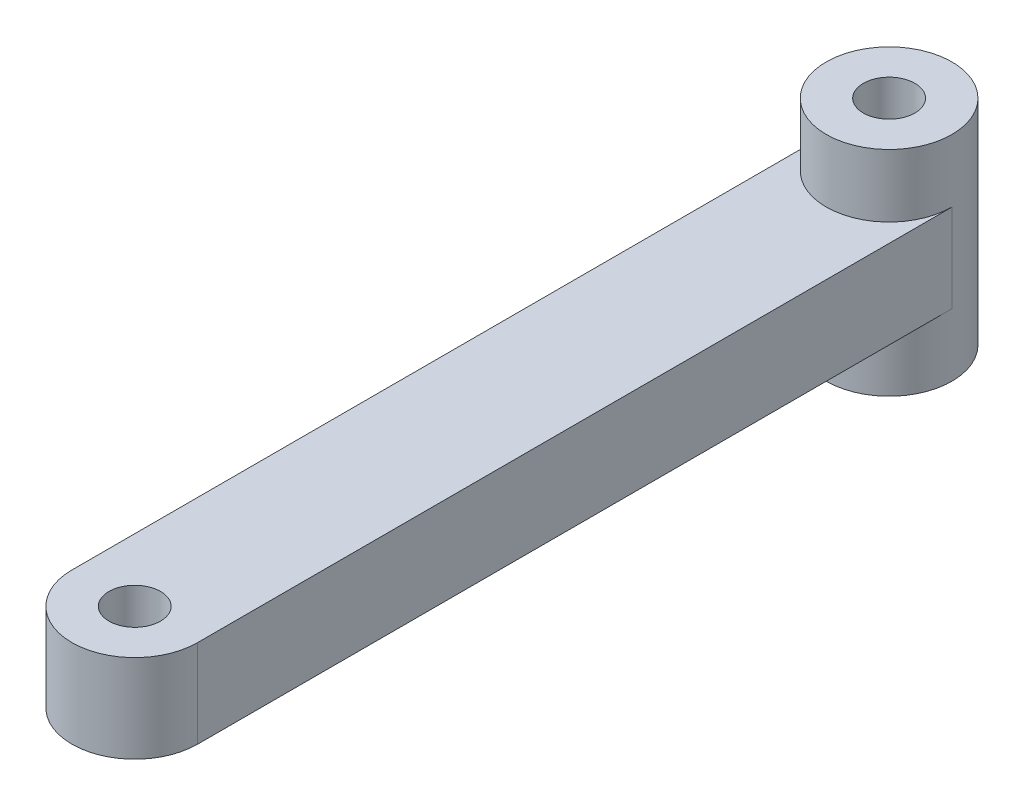
from build123d import *
from build123d.topology import SkipClean

# Parameters (mm, degrees)
ESQUISSE1_R        = 2.05
BOSS_EXTRU_1_DEPTH = 3.5
ESQUISSE2_R        = 5
ESQUISSE2_R_2      = 2.05
BOSS_EXTRU_2_DEPTH = 8.5


with BuildPart() as part:
    # Esquisse1 → Boss.-Extru.1 (new, symmetric)
    with BuildSketch(Plane(origin=(0, 0, 0), x_dir=(1, 0, 0), z_dir=(0, 1, 0))):
        with BuildLine():
            Line((-5, 0), (-5, 60))
            ThreePointArc((-5, 60), (0, 65), (5, 60))
            Line((5, 60), (5, 0))
            ThreePointArc((5, 0), (0, -5), (-5, 0))
        make_face()
        with Locations((0, 60)):
            Circle(ESQUISSE1_R, mode=Mode.SUBTRACT)
        Circle(ESQUISSE1_R, mode=Mode.SUBTRACT)
    extrude(amount=BOSS_EXTRU_1_DEPTH, both=True)

    # Esquisse2 → Boss.-Extru.2 (add, symmetric)
    with SkipClean():  # the faces are left unmerged after this step: merging them gives an invalid solid
        with BuildSketch(Plane(origin=(0, 0, 0), x_dir=(1, 0, 0), z_dir=(0, 1, 0))):
            with Locations((0, 60)):
                Circle(ESQUISSE2_R)
            with Locations((0, 60)):
                Circle(ESQUISSE2_R_2, mode=Mode.SUBTRACT)
        extrude(amount=BOSS_EXTRU_2_DEPTH, both=True)


solid = part.part
